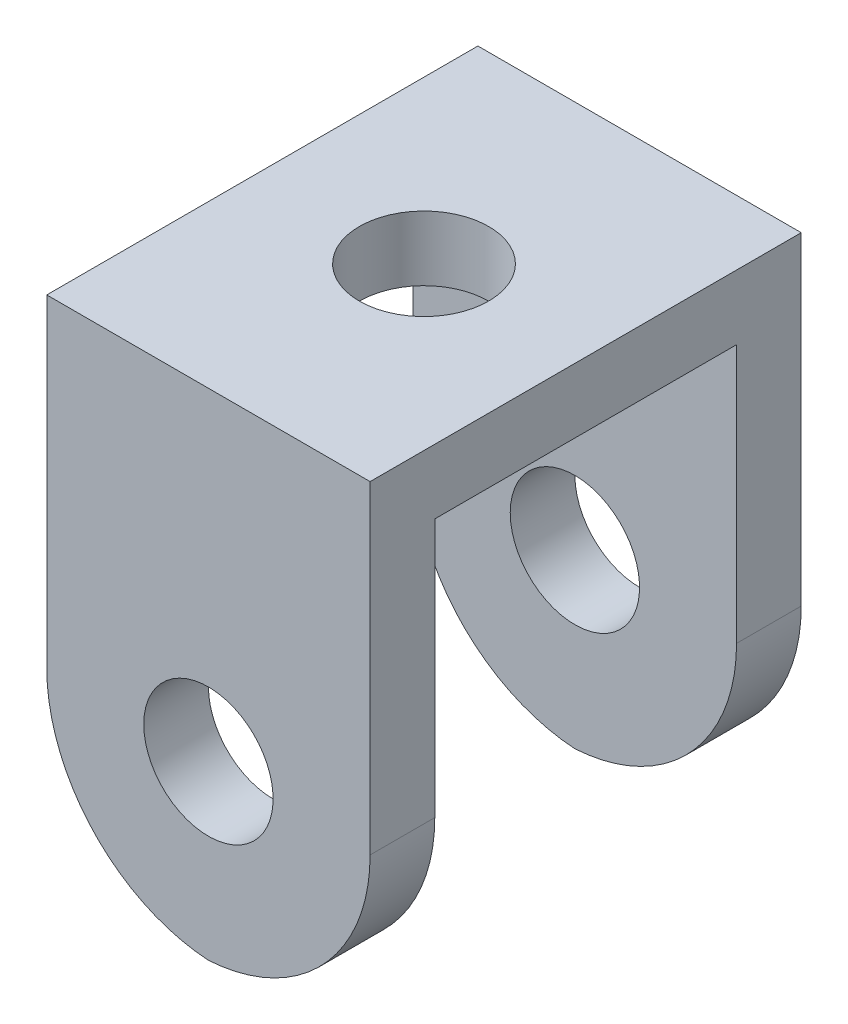
from build123d import *

# Parameters (mm, degrees)
SKETCH1_W           = 15
SKETCH1_H           = 20
BOSS_EXTRUDE1_DEPTH = 3
SKETCH3_W           = 15
SKETCH3_H           = 3
BOSS_EXTRUDE3_DEPTH = 20
SKETCH4_R           = 3
CUT_EXTRUDE1_DEPTH  = 30.261749777
SKETCH2_R           = 3
CUT_EXTRUDE2_DEPTH  = 15
FILLET1_R           = 8


with BuildPart() as part:
    # Sketch1 → Boss-Extrude1 (new body)
    with BuildSketch(Plane(origin=(0, 0, 0), x_dir=(1, 0, 0), z_dir=(0, 1, 0))):
        Rectangle(SKETCH1_W, SKETCH1_H)
    extrude(amount=BOSS_EXTRUDE1_DEPTH)

    # Sketch3 → Boss-Extrude3 (add)
    with BuildSketch(Plane.XZ):
        with Locations((0, -8.5)):
            Rectangle(SKETCH3_W, SKETCH3_H)
        with Locations((0, 8.5)):
            Rectangle(SKETCH3_W, SKETCH3_H)
    extrude(amount=BOSS_EXTRUDE3_DEPTH)

    # Sketch4 → Cut-Extrude1 (cut, through all)
    with BuildSketch(Plane(origin=(0, 0, -10), x_dir=(-1, 0, 0), z_dir=(0, 0, -1))):
        with Locations((0, -12)):
            Circle(SKETCH4_R)
    extrude(amount=-CUT_EXTRUDE1_DEPTH, mode=Mode.SUBTRACT)

    # Sketch2 → Cut-Extrude2 (cut)
    with BuildSketch(Plane(origin=(0, 3, 0), x_dir=(1, 0, 0), z_dir=(0, 1, 0))):
        with Locations(Location((0, 0, 0), (0, 0, 270))):
            Circle(SKETCH2_R)
    extrude(amount=-CUT_EXTRUDE2_DEPTH, mode=Mode.SUBTRACT)

    # Fillet1
    # the kernel refuses this fillet: 8 mm, written as the material it takes off along each edge
    with BuildSketch(Plane(origin=(-7.5, -20, 30), x_dir=(0, 1, 0), z_dir=(0, 0, -1)), Plane(origin=(7.5, -20, -13), x_dir=(0, 1, 0), z_dir=(0, 0, 1))) as fillet1_piece_1:
        with BuildLine():
            CenterArc((FILLET1_R, FILLET1_R), FILLET1_R, 180, 90)
            Line((0, FILLET1_R), (0, 0))
            Line((0, 0), (FILLET1_R, 0))
        make_face()
    extrude(amount=43, mode=Mode.SUBTRACT)
    with BuildSketch(Plane(origin=(7.5, -20, 13), x_dir=(0, 1, 0), z_dir=(0, 0, -1)), Plane(origin=(-7.5, -20, -30), x_dir=(0, 1, 0), z_dir=(0, 0, 1))) as fillet1_piece_2:
        with BuildLine():
            CenterArc((FILLET1_R, -FILLET1_R), FILLET1_R, 90, 90)
            Line((0, -FILLET1_R), (0, 0))
            Line((0, 0), (FILLET1_R, 0))
        make_face()
    extrude(amount=43, mode=Mode.SUBTRACT)


solid = part.part
